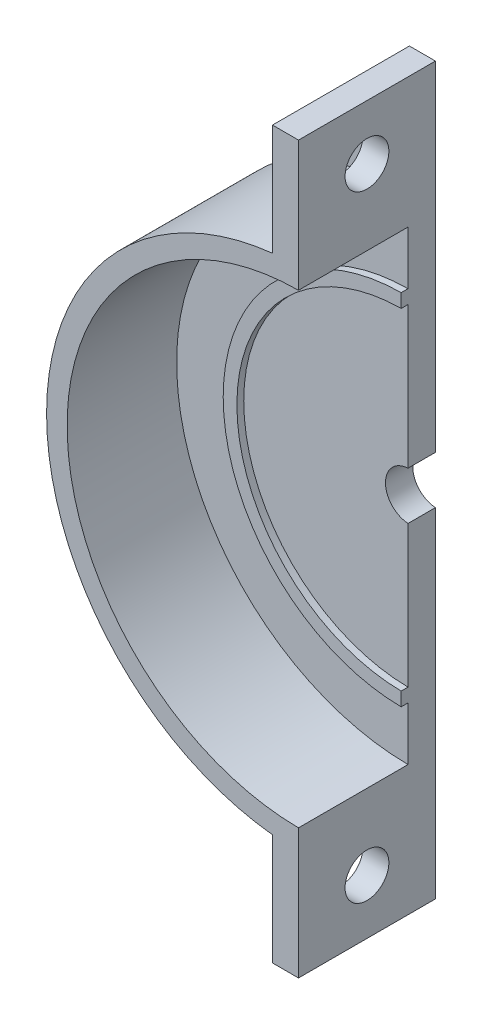
from build123d import *

# Parameters (mm, degrees)
BOSS_EXTRUDE1_DEPTH = 2
BOSS_EXTRUDE2_DEPTH = 10
BOSS_EXTRUDE3_DEPTH = 10
SKETCH3_R           = 1.6
CUT_EXTRUDE1_DEPTH  = 10
BOSS_EXTRUDE4_DEPTH = 1
MOVE_FACE1_DEPTH    = 10
BOSS_EXTRUDE5_DEPTH = 0.5


# Read off the part's stored shape, not the designer's step: Move Face1
with BuildPart() as part:
    # Sketch1 → Boss-Extrude1 (new body)
    with BuildSketch(Plane.XY):
        with BuildLine():
            Line((0, 17), (0, 1.65))
            ThreePointArc((0, 1.65), (-1.65, 0), (0, -1.65))
            Line((0, -1.65), (0, -17))
            ThreePointArc((0, -17), (-17, 0), (0, 17))
        make_face()
    extrude(amount=BOSS_EXTRUDE1_DEPTH)

    # Sketch2 → Boss-Extrude2 (add)
    with BuildSketch(Plane.XY):
        with BuildLine():
            Line((0, 17), (0, 18.5))
            ThreePointArc((0, 18.5), (-18.5, 0), (0, -18.5))
            Line((0, -18.5), (0, -17))
            ThreePointArc((0, -17), (-17, 0), (0, 17))
        make_face()
    extrude(amount=BOSS_EXTRUDE2_DEPTH)

    # Sketch4 → Boss-Extrude3 (add)
    with BuildSketch(Plane.XY.offset(10)):
        Polygon((0, -18.5), (-1.127101366, -17.373839009), (-2, -17.373839009), (-2, -22.499993139), (-2, -26.5), (0, -26.5), align=None)
    boss_extrude3 = extrude(amount=-BOSS_EXTRUDE3_DEPTH)

    # Sketch3 → Cut-Extrude1 (cut)
    with BuildSketch(Plane(origin=(0, 0, 0), x_dir=(0, 0, -1), z_dir=(1, 0, 0))):
        with Locations(Location((-5, -22.5, 0), (0, 0, 90))):
            Circle(SKETCH3_R)
    cut_extrude1 = extrude(amount=-CUT_EXTRUDE1_DEPTH, mode=Mode.SUBTRACT)

    # Sketch5 → Boss-Extrude4 (add)
    with BuildSketch(Plane(origin=(0, 0, 0), x_dir=(-1, 0, 0), z_dir=(0, 0, -1))):
        Polygon((2, -26.5), (6.889586723, -17.169263082), (2, -17.169263082), align=None)
    boss_extrude4 = extrude(amount=-BOSS_EXTRUDE4_DEPTH)

    # Mirror1: Boss-Extrude3, Cut-Extrude1, Boss-Extrude4 across plane
    add(boss_extrude3.mirror(Plane.ZX))
    add(cut_extrude1.mirror(Plane.ZX), mode=Mode.SUBTRACT)
    add(boss_extrude4.mirror(Plane.ZX))

    # Move Face1 outline → Move Face1 (cut)
    with BuildSketch(Plane.XY):
        with BuildLine():
            ThreePointArc((-0.1, 1.747140521), (-1.75, 0), (-0.1, -1.747140521))
            Line((-0.1, -1.747140521), (-0.1, -26.5))
            Line((-0.1, -26.5), (0, -26.5))
            Line((0, -26.5), (0, -1.65))
            ThreePointArc((0, -1.65), (-1.65, 0), (0, 1.65))
            Line((0, 1.65), (0, 26.5))
            Line((0, 26.5), (-0.1, 26.5))
            Line((-0.1, 26.5), (-0.1, 1.747140521))
        make_face()
    extrude(amount=MOVE_FACE1_DEPTH, mode=Mode.SUBTRACT)

    # Sketch6 → Boss-Extrude5 (add)
    with BuildSketch(Plane.XY.offset(2)):
        with BuildLine():
            Line((-0.1, 13.099618315), (-0.1, 12.09958677))
            ThreePointArc((-0.1, 12.09958677), (-12.1, 0), (-0.1, -12.09958677))
            Line((-0.1, -12.09958677), (-0.1, -13.099618315))
            ThreePointArc((-0.1, -13.099618315), (-13.1, 0), (-0.1, 13.099618315))
        make_face()
    extrude(amount=BOSS_EXTRUDE5_DEPTH)


solid = part.part
